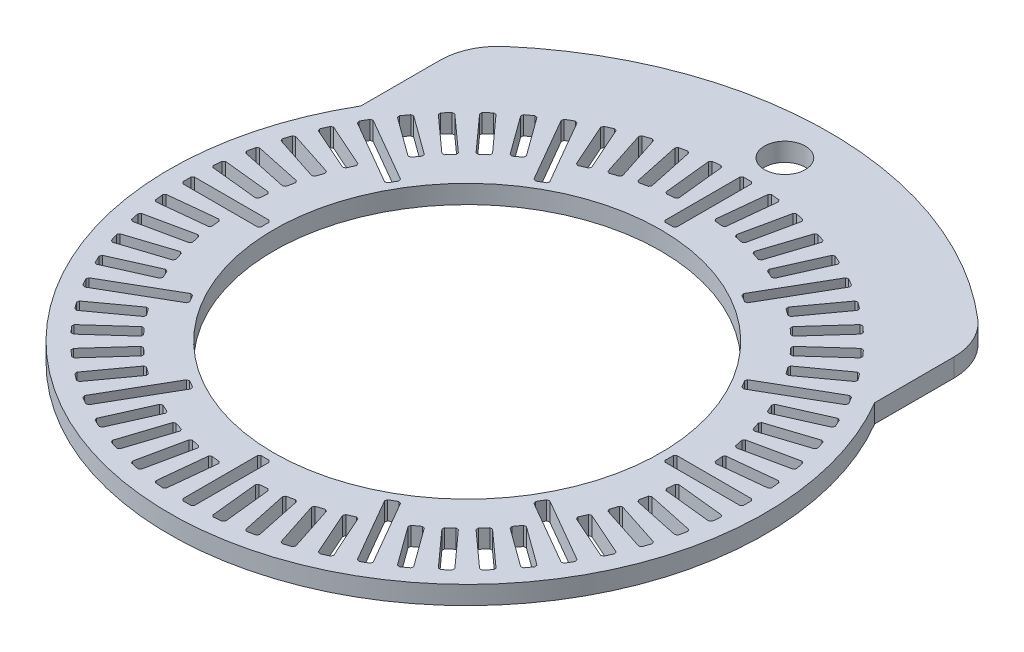
from build123d import *

# Parameters (mm, degrees)
SKETCH1_R                    = 32.385
BOSS_EXTRUDE1_DEPTH          = 2
FILLET1_R                    = 6.35
SKETCH2_R                    = 2.2225
CUT_EXTRUDE1_DEPTH           = 52.017498224
SKETCH3_W                    = 1.27
SKETCH3_H                    = 5.588
CUT_EXTRUDE2_DEPTH           = 52.017498224
CHAMFER1_SIZE                = 0.1905
CIRPATTERN1_DEPTH            = 2
SKETCH4_W                    = 1.27
SKETCH4_H                    = 5.715
CUT_EXTRUDE3_DEPTH           = 52.017498224
CHAMFER2_SIZE                = 0.1905
CIRPATTERN2_COUNT            = 12
CHAMFER2_OF_CIRPATTERN2_SIZE = 0.1905
SKETCH5_R                    = 21.0312
CUT_EXTRUDE4_DEPTH           = 52.017498224


# Read off the part's stored shape, not the designer's step: CirPattern1
with BuildPart() as part:
    # Sketch1 → Boss-Extrude1 (new body)
    with BuildSketch(Plane(origin=(0, 0, 0), x_dir=(1, 0, 0), z_dir=(0, 1, 0))):
        Circle(SKETCH1_R)
        with BuildLine():
            Line((-27.94, 27.737218678), (-27.94, 16.375122137))
            ThreePointArc((-27.94, 16.375122137), (0, 32.385), (27.94, 16.375122137))
            Line((27.94, 16.375122137), (27.94, 27.737218678))
            ThreePointArc((27.94, 27.737218678), (0, 39.37), (-27.94, 27.737218678))
        make_face()
    extrude(amount=BOSS_EXTRUDE1_DEPTH)

    # Fillet1
    fillet1_edges = [part.edges().sort_by_distance(p)[0] for p in [
        (-27.94, 1, -27.737218678),
        (27.94, 1, -27.737218678),
    ]]
    fillet(fillet1_edges, radius=FILLET1_R)

    # Sketch2 → Cut-Extrude1 (cut, through all)
    with BuildSketch(Plane(origin=(0, 2, 0), x_dir=(1, 0, 0), z_dir=(0, 1, 0))):
        with Locations(Location((0, 34.544, 0), (0, 0, 270))):
            Circle(SKETCH2_R)
    extrude(amount=-CUT_EXTRUDE1_DEPTH, mode=Mode.SUBTRACT)

    # Sketch3 → Cut-Extrude2 (cut, through all)
    with BuildSketch(Plane(origin=(0, 2, 0), x_dir=(1, 0, 0), z_dir=(0, 1, 0))):
        with Locations((0, -27.686)):
            Rectangle(SKETCH3_W, SKETCH3_H)
    extrude(amount=-CUT_EXTRUDE2_DEPTH, mode=Mode.SUBTRACT)

    # Chamfer1
    chamfer1_edges = [part.edges().sort_by_distance(p)[0] for p in [
        (-0.635, 1, 30.48),
        (-0.635, 1, 24.892),
        (0.635, 1, 24.892),
        (0.635, 1, 30.48),
    ]]
    chamfer(chamfer1_edges, length=CHAMFER1_SIZE)

    # CirPattern1 outline → CirPattern1 (cut)
    with BuildSketch(Plane(origin=(0, 0, 0), x_dir=(1, 0, 0), z_dir=(0, 1, 0))):
        Polygon((-0.4445, 30.48), (-0.635, 30.2895), (-0.635, 25.0825), (-0.4445, 24.892), (0.4445, 24.892), (0.635, 25.0825), (0.635, 30.2895), (0.4445, 30.48), align=None)
        Polygon((-30.48, -0.4445), (-30.2895, -0.635), (-25.0825, -0.635), (-24.892, -0.4445), (-24.892, 0.4445), (-25.0825, 0.635), (-30.2895, 0.635), (-30.48, 0.4445), align=None)
        Polygon((30.2895, -0.635), (30.48, -0.4445), (30.48, 0.4445), (30.2895, 0.635), (25.0825, 0.635), (24.892, 0.4445), (24.892, -0.4445), (25.0825, -0.635), align=None)
        Polygon((2.159857525, -24.802101921), (1.990313776, -25.011471015), (2.534593485, -30.189946524), (2.743962578, -30.359490273), (3.628092543, -30.266564469), (3.797636292, -30.057195376), (3.253356583, -24.878719866), (3.04398749, -24.709176118), align=None)
        Polygon((-3.628092543, 30.266564469), (-3.797636292, 30.057195376), (-3.253356583, 24.878719866), (-3.04398749, 24.709176118), (-2.159857525, 24.802101921), (-1.990313776, 25.011471015), (-2.534593485, 30.189946524), (-2.743962578, 30.359490273), align=None)
        Polygon((4.740551199, -24.440466824), (4.593821258, -24.666411119), (5.676417433, -29.759625676), (5.902361728, -29.906355617), (6.771934945, -29.721522124), (6.918664885, -29.495577829), (5.836068711, -24.402363272), (5.610124416, -24.255633331), align=None)
        Polygon((-6.771934945, 29.721522124), (-6.918664885, 29.495577829), (-5.836068711, 24.402363272), (-5.610124416, 24.255633331), (-4.740551199, 24.440466824), (-4.593821258, 24.666411119), (-5.676417433, 29.759625676), (-5.902361728, 29.906355617), align=None)
        Polygon((7.269306402, -23.811056858), (7.146997874, -24.051100861), (8.756049363, -29.003252142), (8.996093367, -29.125560671), (9.84158261, -28.850844563), (9.963891139, -28.610800559), (8.354839649, -23.658649279), (8.114795645, -23.53634075), align=None)
        Polygon((-9.84158261, 28.850844563), (-9.963891139, 28.610800559), (-8.354839649, 23.658649279), (-8.114795645, 23.53634075), (-7.269306402, 23.811056858), (-7.146997874, 24.051100861), (-8.756049363, 29.003252142), (-8.996093367, 29.125560671), align=None)
        Polygon((9.718417564, -22.920767969), (9.621870484, -23.17228171), (11.739748185, -27.929112908), (11.991261925, -28.025659987), (12.803403837, -27.664071111), (12.899950916, -27.412557371), (10.782073216, -22.655726173), (10.530559475, -22.559179094), align=None)
        Polygon((-12.803403837, 27.664071111), (-12.899950916, 27.412557371), (-10.782073216, 22.655726173), (-10.530559475, 22.559179094), (-9.718417564, 22.920767969), (-9.621870484, 23.17228171), (-11.739748185, 27.929112908), (-11.991261925, 28.025659987), align=None)
        Polygon((12.061051708, -21.779354351), (11.991323869, -22.03958219), (14.594823869, -26.548976468), (14.855051708, -26.618704307), (15.624948292, -26.174204307), (15.694676131, -25.913976468), (13.091176131, -21.40458219), (12.830948292, -21.334854351), align=None)
        Polygon((-15.624948292, 26.174204307), (-15.694676131, 25.913976468), (-13.091176131, 21.40458219), (-12.830948292, 21.334854351), (-12.061051708, 21.779354351), (-11.991323869, 22.03958219), (-14.594823869, 26.548976468), (-14.855051708, 26.618704307), align=None)
        Polygon((14.271542446, -20.399321569), (14.229397799, -20.665412397), (17.289995608, -24.877963886), (17.556086436, -24.920108533), (18.275302544, -24.397567444), (18.317447191, -24.131476616), (15.256849382, -19.918925126), (14.990758554, -19.876780479), align=None)
        Polygon((-18.275302544, 24.397567444), (-18.317447191, 24.131476616), (-15.256849382, 19.918925126), (-14.990758554, 19.876780479), (-14.271542446, 20.399321569), (-14.229397799, 20.665412397), (-17.289995608, 24.877963886), (-17.556086436, 24.920108533), align=None)
        Polygon((16.325671179, -18.79578955), (16.31157147, -19.06482802), (19.795734537, -22.934383126), (20.064773007, -22.948482835), (20.725428757, -22.353625726), (20.739528465, -22.084587256), (17.255365398, -18.21503215), (16.986326928, -18.200932441), align=None)
        Polygon((-20.725428757, 22.353625726), (-20.739528465, 22.084587256), (-17.255365398, 18.21503215), (-16.986326928, 18.200932441), (-16.325671179, 18.79578955), (-16.31157147, 19.06482802), (-19.795734537, 22.934383126), (-20.064773007, 22.948482835), align=None)
        Polygon((18.200932441, -16.986326928), (18.21503215, -17.255365398), (22.084587256, -20.739528465), (22.353625726, -20.725428757), (22.948482835, -20.064773007), (22.934383126, -19.795734537), (19.06482802, -16.31157147), (18.79578955, -16.325671179), align=None)
        Polygon((-22.948482835, 20.064773007), (-22.934383126, 19.795734537), (-19.06482802, 16.31157147), (-18.79578955, 16.325671179), (-18.200932441, 16.986326928), (-18.21503215, 17.255365398), (-22.084587256, 20.739528465), (-22.353625726, 20.725428757), align=None)
        Polygon((19.876780479, -14.990758554), (19.918925126, -15.256849382), (24.131476616, -18.317447191), (24.397567444, -18.275302544), (24.920108533, -17.556086436), (24.877963886, -17.289995608), (20.665412397, -14.229397799), (20.399321569, -14.271542446), align=None)
        Polygon((-24.920108533, 17.556086436), (-24.877963886, 17.289995608), (-20.665412397, 14.229397799), (-20.399321569, 14.271542446), (-19.876780479, 14.990758554), (-19.918925126, 15.256849382), (-24.131476616, 18.317447191), (-24.397567444, 18.275302544), align=None)
        Polygon((21.334854351, -12.830948292), (21.40458219, -13.091176131), (25.913976468, -15.694676131), (26.174204307, -15.624948292), (26.618704307, -14.855051708), (26.548976468, -14.594823869), (22.03958219, -11.991323869), (21.779354351, -12.061051708), align=None)
        Polygon((-26.618704307, 14.855051708), (-26.548976468, 14.594823869), (-22.03958219, 11.991323869), (-21.779354351, 12.061051708), (-21.334854351, 12.830948292), (-21.40458219, 13.091176131), (-25.913976468, 15.694676131), (-26.174204307, 15.624948292), align=None)
        Polygon((22.559179094, -10.530559475), (22.655726173, -10.782073216), (27.412557371, -12.899950916), (27.664071111, -12.803403837), (28.025659987, -11.991261925), (27.929112908, -11.739748185), (23.17228171, -9.621870484), (22.920767969, -9.718417564), align=None)
        Polygon((-28.025659987, 11.991261925), (-27.929112908, 11.739748185), (-23.17228171, 9.621870484), (-22.920767969, 9.718417564), (-22.559179094, 10.530559475), (-22.655726173, 10.782073216), (-27.412557371, 12.899950916), (-27.664071111, 12.803403837), align=None)
        Polygon((23.53634075, -8.114795645), (23.658649279, -8.354839649), (28.610800559, -9.963891139), (28.850844563, -9.84158261), (29.125560671, -8.996093367), (29.003252142, -8.756049363), (24.051100861, -7.146997874), (23.811056858, -7.269306402), align=None)
        Polygon((-29.125560671, 8.996093367), (-29.003252142, 8.756049363), (-24.051100861, 7.146997874), (-23.811056858, 7.269306402), (-23.53634075, 8.114795645), (-23.658649279, 8.354839649), (-28.610800559, 9.963891139), (-28.850844563, 9.84158261), align=None)
        Polygon((24.255633331, -5.610124416), (24.402363272, -5.836068711), (29.495577829, -6.918664885), (29.721522124, -6.771934945), (29.906355617, -5.902361728), (29.759625676, -5.676417433), (24.666411119, -4.593821258), (24.440466824, -4.740551199), align=None)
        Polygon((-29.906355617, 5.902361728), (-29.759625676, 5.676417433), (-24.666411119, 4.593821258), (-24.440466824, 4.740551199), (-24.255633331, 5.610124416), (-24.402363272, 5.836068711), (-29.495577829, 6.918664885), (-29.721522124, 6.771934945), align=None)
        Polygon((24.709176118, -3.04398749), (24.878719866, -3.253356583), (30.057195376, -3.797636292), (30.266564469, -3.628092543), (30.359490273, -2.743962578), (30.189946524, -2.534593485), (25.011471015, -1.990313776), (24.802101921, -2.159857525), align=None)
        Polygon((-30.359490273, 2.743962578), (-30.189946524, 2.534593485), (-25.011471015, 1.990313776), (-24.802101921, 2.159857525), (-24.709176118, 3.04398749), (-24.878719866, 3.253356583), (-30.057195376, 3.797636292), (-30.266564469, 3.628092543), align=None)
        Polygon((24.802101921, 2.159857525), (25.011471015, 1.990313776), (30.189946524, 2.534593485), (30.359490273, 2.743962578), (30.266564469, 3.628092543), (30.057195376, 3.797636292), (24.878719866, 3.253356583), (24.709176118, 3.04398749), align=None)
        Polygon((-30.266564469, -3.628092543), (-30.057195376, -3.797636292), (-24.878719866, -3.253356583), (-24.709176118, -3.04398749), (-24.802101921, -2.159857525), (-25.011471015, -1.990313776), (-30.189946524, -2.534593485), (-30.359490273, -2.743962578), align=None)
        Polygon((24.440466824, 4.740551199), (24.666411119, 4.593821258), (29.759625676, 5.676417433), (29.906355617, 5.902361728), (29.721522124, 6.771934945), (29.495577829, 6.918664885), (24.402363272, 5.836068711), (24.255633331, 5.610124416), align=None)
        Polygon((-29.721522124, -6.771934945), (-29.495577829, -6.918664885), (-24.402363272, -5.836068711), (-24.255633331, -5.610124416), (-24.440466824, -4.740551199), (-24.666411119, -4.593821258), (-29.759625676, -5.676417433), (-29.906355617, -5.902361728), align=None)
        Polygon((23.811056858, 7.269306402), (24.051100861, 7.146997874), (29.003252142, 8.756049363), (29.125560671, 8.996093367), (28.850844563, 9.84158261), (28.610800559, 9.963891139), (23.658649279, 8.354839649), (23.53634075, 8.114795645), align=None)
        Polygon((-28.850844563, -9.84158261), (-28.610800559, -9.963891139), (-23.658649279, -8.354839649), (-23.53634075, -8.114795645), (-23.811056858, -7.269306402), (-24.051100861, -7.146997874), (-29.003252142, -8.756049363), (-29.125560671, -8.996093367), align=None)
        Polygon((22.920767969, 9.718417564), (23.17228171, 9.621870484), (27.929112908, 11.739748185), (28.025659987, 11.991261925), (27.664071111, 12.803403837), (27.412557371, 12.899950916), (22.655726173, 10.782073216), (22.559179094, 10.530559475), align=None)
        Polygon((-27.664071111, -12.803403837), (-27.412557371, -12.899950916), (-22.655726173, -10.782073216), (-22.559179094, -10.530559475), (-22.920767969, -9.718417564), (-23.17228171, -9.621870484), (-27.929112908, -11.739748185), (-28.025659987, -11.991261925), align=None)
        Polygon((21.779354351, 12.061051708), (22.03958219, 11.991323869), (26.548976468, 14.594823869), (26.618704307, 14.855051708), (26.174204307, 15.624948292), (25.913976468, 15.694676131), (21.40458219, 13.091176131), (21.334854351, 12.830948292), align=None)
        Polygon((-26.174204307, -15.624948292), (-25.913976468, -15.694676131), (-21.40458219, -13.091176131), (-21.334854351, -12.830948292), (-21.779354351, -12.061051708), (-22.03958219, -11.991323869), (-26.548976468, -14.594823869), (-26.618704307, -14.855051708), align=None)
        Polygon((20.399321569, 14.271542446), (20.665412397, 14.229397799), (24.877963886, 17.289995608), (24.920108533, 17.556086436), (24.397567444, 18.275302544), (24.131476616, 18.317447191), (19.918925126, 15.256849382), (19.876780479, 14.990758554), align=None)
        Polygon((-24.397567444, -18.275302544), (-24.131476616, -18.317447191), (-19.918925126, -15.256849382), (-19.876780479, -14.990758554), (-20.399321569, -14.271542446), (-20.665412397, -14.229397799), (-24.877963886, -17.289995608), (-24.920108533, -17.556086436), align=None)
        Polygon((18.79578955, 16.325671179), (19.06482802, 16.31157147), (22.934383126, 19.795734537), (22.948482835, 20.064773007), (22.353625726, 20.725428757), (22.084587256, 20.739528465), (18.21503215, 17.255365398), (18.200932441, 16.986326928), align=None)
        Polygon((-22.353625726, -20.725428757), (-22.084587256, -20.739528465), (-18.21503215, -17.255365398), (-18.200932441, -16.986326928), (-18.79578955, -16.325671179), (-19.06482802, -16.31157147), (-22.934383126, -19.795734537), (-22.948482835, -20.064773007), align=None)
        Polygon((16.986326928, 18.200932441), (17.255365398, 18.21503215), (20.739528465, 22.084587256), (20.725428757, 22.353625726), (20.064773007, 22.948482835), (19.795734537, 22.934383126), (16.31157147, 19.06482802), (16.325671179, 18.79578955), align=None)
        Polygon((-20.064773007, -22.948482835), (-19.795734537, -22.934383126), (-16.31157147, -19.06482802), (-16.325671179, -18.79578955), (-16.986326928, -18.200932441), (-17.255365398, -18.21503215), (-20.739528465, -22.084587256), (-20.725428757, -22.353625726), align=None)
        Polygon((14.990758554, 19.876780479), (15.256849382, 19.918925126), (18.317447191, 24.131476616), (18.275302544, 24.397567444), (17.556086436, 24.920108533), (17.289995608, 24.877963886), (14.229397799, 20.665412397), (14.271542446, 20.399321569), align=None)
        Polygon((-17.556086436, -24.920108533), (-17.289995608, -24.877963886), (-14.229397799, -20.665412397), (-14.271542446, -20.399321569), (-14.990758554, -19.876780479), (-15.256849382, -19.918925126), (-18.317447191, -24.131476616), (-18.275302544, -24.397567444), align=None)
        Polygon((12.830948292, 21.334854351), (13.091176131, 21.40458219), (15.694676131, 25.913976468), (15.624948292, 26.174204307), (14.855051708, 26.618704307), (14.594823869, 26.548976468), (11.991323869, 22.03958219), (12.061051708, 21.779354351), align=None)
        Polygon((-14.855051708, -26.618704307), (-14.594823869, -26.548976468), (-11.991323869, -22.03958219), (-12.061051708, -21.779354351), (-12.830948292, -21.334854351), (-13.091176131, -21.40458219), (-15.694676131, -25.913976468), (-15.624948292, -26.174204307), align=None)
        Polygon((10.530559475, 22.559179094), (10.782073216, 22.655726173), (12.899950916, 27.412557371), (12.803403837, 27.664071111), (11.991261925, 28.025659987), (11.739748185, 27.929112908), (9.621870484, 23.17228171), (9.718417564, 22.920767969), align=None)
        Polygon((-11.991261925, -28.025659987), (-11.739748185, -27.929112908), (-9.621870484, -23.17228171), (-9.718417564, -22.920767969), (-10.530559475, -22.559179094), (-10.782073216, -22.655726173), (-12.899950916, -27.412557371), (-12.803403837, -27.664071111), align=None)
        Polygon((8.114795645, 23.53634075), (8.354839649, 23.658649279), (9.963891139, 28.610800559), (9.84158261, 28.850844563), (8.996093367, 29.125560671), (8.756049363, 29.003252142), (7.146997874, 24.051100861), (7.269306402, 23.811056858), align=None)
        Polygon((-8.996093367, -29.125560671), (-8.756049363, -29.003252142), (-7.146997874, -24.051100861), (-7.269306402, -23.811056858), (-8.114795645, -23.53634075), (-8.354839649, -23.658649279), (-9.963891139, -28.610800559), (-9.84158261, -28.850844563), align=None)
        Polygon((5.610124416, 24.255633331), (5.836068711, 24.402363272), (6.918664885, 29.495577829), (6.771934945, 29.721522124), (5.902361728, 29.906355617), (5.676417433, 29.759625676), (4.593821258, 24.666411119), (4.740551199, 24.440466824), align=None)
        Polygon((-5.902361728, -29.906355617), (-5.676417433, -29.759625676), (-4.593821258, -24.666411119), (-4.740551199, -24.440466824), (-5.610124416, -24.255633331), (-5.836068711, -24.402363272), (-6.918664885, -29.495577829), (-6.771934945, -29.721522124), align=None)
        Polygon((3.04398749, 24.709176118), (3.253356583, 24.878719866), (3.797636292, 30.057195376), (3.628092543, 30.266564469), (2.743962578, 30.359490273), (2.534593485, 30.189946524), (1.990313776, 25.011471015), (2.159857525, 24.802101921), align=None)
        Polygon((-2.743962578, -30.359490273), (-2.534593485, -30.189946524), (-1.990313776, -25.011471015), (-2.159857525, -24.802101921), (-3.04398749, -24.709176118), (-3.253356583, -24.878719866), (-3.797636292, -30.057195376), (-3.628092543, -30.266564469), align=None)
    extrude(amount=CIRPATTERN1_DEPTH, mode=Mode.SUBTRACT)

    # Sketch4 → Cut-Extrude3 (cut, through all)
    with BuildSketch(Plane(origin=(0, 2, 0), x_dir=(1, 0, 0), z_dir=(0, 1, 0))):
        with Locations((0, -24.8285)):
            Rectangle(SKETCH4_W, SKETCH4_H)
    cut_extrude3 = extrude(amount=-CUT_EXTRUDE3_DEPTH, mode=Mode.SUBTRACT)

    # Chamfer2
    chamfer2_edges = [part.edges().sort_by_distance(p)[0] for p in [
        (0.635, 1, 21.971),
        (-0.635, 1, 21.971),
    ]]
    chamfer(chamfer2_edges, length=CHAMFER2_SIZE)

    # CirPattern2: Cut-Extrude3 ×12 about axis
    cirpattern2_axis = Axis((0, 0, 0), (0, 1, 0))
    for i in range(1, CIRPATTERN2_COUNT):
        add(cut_extrude3.rotate(cirpattern2_axis, i * 360 / CIRPATTERN2_COUNT), mode=Mode.SUBTRACT)

    # Chamfer2 of CirPattern2
    chamfer2_of_cirpattern2_edges = [part.edges().sort_by_distance(p)[0] for p in [
        (11.535426131, 1, 18.709944147),
        (10.435573869, 1, 19.344944147),
        (19.344944147, 1, 10.435573869),
        (18.709944147, 1, 11.535426131),
        (21.971, 1, -0.635),
        (21.971, 1, 0.635),
        (18.709944147, 1, -11.535426131),
        (19.344944147, 1, -10.435573869),
        (10.435573869, 1, -19.344944147),
        (11.535426131, 1, -18.709944147),
        (-0.635, 1, -21.971),
        (0.635, 1, -21.971),
        (-11.535426131, 1, -18.709944147),
        (-10.435573869, 1, -19.344944147),
        (-19.344944147, 1, -10.435573869),
        (-18.709944147, 1, -11.535426131),
        (-21.971, 1, 0.635),
        (-21.971, 1, -0.635),
        (-18.709944147, 1, 11.535426131),
        (-19.344944147, 1, 10.435573869),
        (-10.435573869, 1, 19.344944147),
        (-11.535426131, 1, 18.709944147),
    ]]
    chamfer(chamfer2_of_cirpattern2_edges, length=CHAMFER2_OF_CIRPATTERN2_SIZE)

    # Sketch5 → Cut-Extrude4 (cut, through all)
    with BuildSketch(Plane(origin=(0, 2, 0), x_dir=(1, 0, 0), z_dir=(0, 1, 0))):
        with Locations(Location((0, 0, 0), (0, 0, 270))):
            Circle(SKETCH5_R)
    extrude(amount=-CUT_EXTRUDE4_DEPTH, mode=Mode.SUBTRACT)


solid = part.part
